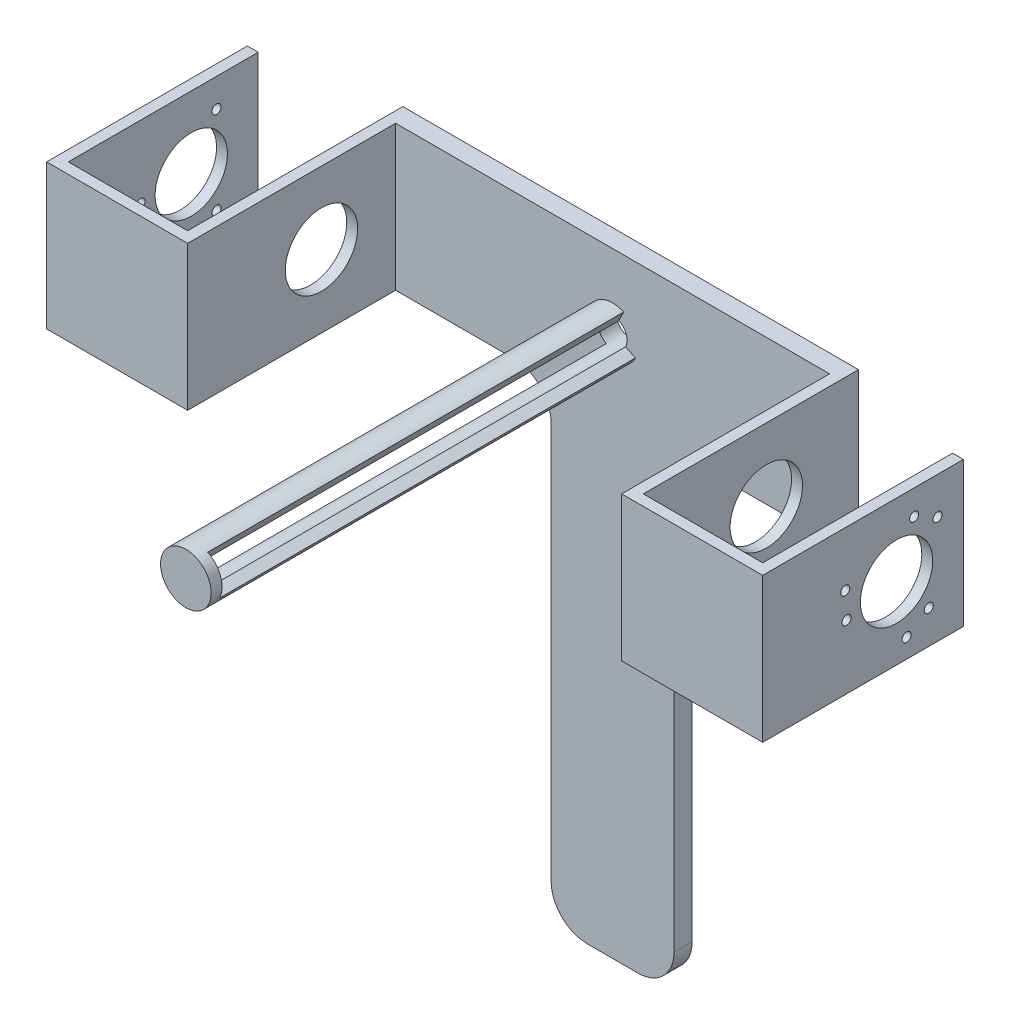
from build123d import *
from build123d.topology import SkipClean

# Parameters (mm, degrees)
BOSS_EXTRUDE2_DEPTH      = 3
BOSS_EXTRUDE2_DEPTH_BACK = 2
SKETCH2_W                = 3
SKETCH2_H                = 40
BOSS_EXTRUDE4_DEPTH      = 39
SKETCH3_W                = 1
SKETCH3_H                = 40
BOSS_EXTRUDE5_DEPTH      = 36
SKETCH4_W                = 1
SKETCH4_H                = 40
BOSS_EXTRUDE6_DEPTH      = 36
SKETCH5_W                = 3
SKETCH5_H                = 40
BOSS_EXTRUDE7_DEPTH      = 36
SKETCH6_R                = 4
CUT_EXTRUDE1_DEPTH       = 228.764510235
CUT_EXTRUDE2_DEPTH       = 36
BOSS_EXTRUDE10_START     = 115
BOSS_EXTRUDE10_DEPTH     = 115
BOSS_EXTRUDE11_START     = 3
SKETCH11_R               = 7
BOSS_EXTRUDE11_DEPTH     = 3
SKETCH12_R               = 10
CUT_EXTRUDE4_DEPTH       = 67
CUT_EXTRUDE5_START       = -67
SKETCH13_R               = 10
CUT_EXTRUDE5_DEPTH       = 67
SKETCH15_W               = 39
SKETCH15_H               = 40
BOSS_EXTRUDE12_DEPTH     = 2
SKETCH16_W               = 33
SKETCH16_H               = 40
CUT_EXTRUDE6_DEPTH       = 52
SKETCH17_W               = 33
SKETCH17_H               = 40
CUT_EXTRUDE7_DEPTH       = 52
SKETCH18_W               = 3
SKETCH18_H               = 40
BOSS_EXTRUDE13_DEPTH     = 16.5
LPATTERN1_COUNT          = 2
LPATTERN1_PITCH          = 36
SKETCH19_W               = 3
SKETCH19_H               = 40
BOSS_EXTRUDE14_DEPTH     = 16.5
LPATTERN2_COUNT          = 2
LPATTERN2_PITCH          = 36
SKETCH21_W               = 3
SKETCH21_H               = 40
BOSS_EXTRUDE16_DEPTH     = 35
SKETCH22_W               = 3
SKETCH22_H               = 40
BOSS_EXTRUDE17_DEPTH     = 35
SKETCH27_R               = 1.25
CUT_EXTRUDE16_DEPTH      = 21
SKETCH29_W               = 32
SKETCH29_H               = 40
CUT_EXTRUDE19_DEPTH      = 10
SKETCH30_W               = 34.030572501
SKETCH30_H               = 34.181917291
CUT_EXTRUDE20_DEPTH      = 10
FILLET1_R                = 10
SKETCH31_R               = 1.25
CUT_EXTRUDE21_DEPTH      = 10


with BuildPart() as part:
    # Sketch1 → Boss-Extrude2 (new, two sides: drawn at the far end of the back side and taken through both)
    with BuildSketch(Plane.XY.offset(-BOSS_EXTRUDE2_DEPTH_BACK)):
        with BuildLine():
            Line((-95, 20), (95, 20))
            Line((95, 20), (95, -20))
            Line((95, -20), (27.321334375, -20))
            ThreePointArc((27.321334375, -20), (20.023048847, -23.023048847), (17, -30.321334375))
            Line((17, -30.321334375), (17, -182.194050733))
            Line((17, -182.194050733), (-17, -182.194050733))
            Line((-17, -182.194050733), (-17, -30.321334375))
            ThreePointArc((-17, -30.321334375), (-20.023048847, -23.023048847), (-27.321334375, -20))
            Line((-27.321334375, -20), (-95, -20))
            Line((-95, -20), (-95, 20))
        make_face()
    extrude(amount=BOSS_EXTRUDE2_DEPTH + BOSS_EXTRUDE2_DEPTH_BACK)

    # Sketch2 → Boss-Extrude4 (add)
    with BuildSketch(Plane.XY.offset(3)):
        with Locations((-93.5, 0)):
            Rectangle(SKETCH2_W, SKETCH2_H)
        with Locations((93.5, 0)):
            Rectangle(SKETCH2_W, SKETCH2_H)
    extrude(amount=BOSS_EXTRUDE4_DEPTH)

    # Sketch3 → Boss-Extrude5 (add)
    with BuildSketch(Plane.ZY.offset(95)):
        with Locations((41.5, 0)):
            Rectangle(SKETCH3_W, SKETCH3_H)
    extrude(amount=BOSS_EXTRUDE5_DEPTH)

    # Sketch4 → Boss-Extrude6 (add)
    with BuildSketch(Plane(origin=(95, 0, 0), x_dir=(0, 0, -1), z_dir=(1, 0, 0))):
        with Locations((-41.5, 0)):
            Rectangle(SKETCH4_W, SKETCH4_H)
    extrude(amount=BOSS_EXTRUDE6_DEPTH)

    # Sketch5 → Boss-Extrude7 (add)
    with BuildSketch(Plane(origin=(0, 0, 41), x_dir=(-1, 0, 0), z_dir=(0, 0, -1))):
        with Locations((-129.5, 0)):
            Rectangle(SKETCH5_W, SKETCH5_H)
        with Locations((129.5, 0)):
            Rectangle(SKETCH5_W, SKETCH5_H)
    extrude(amount=BOSS_EXTRUDE7_DEPTH)

    # Sketch6 → Cut-Extrude1 (cut, through all)
    with BuildSketch(Plane.XY.offset(3)):
        Circle(SKETCH6_R)
    extrude(amount=-CUT_EXTRUDE1_DEPTH, mode=Mode.SUBTRACT)

    # Sketch7 → Cut-Extrude2 (cut)
    with BuildSketch(Plane.XY.offset(3)):
        with BuildLine():
            Line((-17, -182.194050733), (0, -182.194050733))
            ThreePointArc((0, -182.194050733), (-12.02081528, -177.214866013), (-17, -165.194050733))
            Line((-17, -165.194050733), (-17, -182.194050733))
        make_face()
        with BuildLine():
            ThreePointArc((17, -165.194050733), (12.02081528, -177.214866013), (0, -182.194050733))
            Line((0, -182.194050733), (17, -182.194050733))
            Line((17, -182.194050733), (17, -165.194050733))
        make_face()
    extrude(amount=-CUT_EXTRUDE2_DEPTH, mode=Mode.SUBTRACT)

    # Sketch8 → Boss-Extrude10 (add)
    with SkipClean():  # the faces are left unmerged after this step: merging them gives an invalid solid
        with BuildSketch(Plane.XY.offset(3).offset(BOSS_EXTRUDE10_START)):
            with BuildLine():
                Line((-6.304525909, 3.041866706), (-3.602586234, 1.738209546))
                ThreePointArc((-3.602586234, 1.738209546), (-1.318313398, 3.776512913), (1.738209546, 3.602586234))
                Line((1.738209546, 3.602586234), (3.041866706, 6.304525909))
                ThreePointArc((3.041866706, 6.304525909), (-2.307048447, 6.608897598), (-6.304525909, 3.041866706))
            make_face()
            with BuildLine():
                Line((6.304525909, -3.041866706), (3.602586234, -1.738209546))
                ThreePointArc((3.602586234, -1.738209546), (1.318313398, -3.776512913), (-1.738209546, -3.602586234))
                Line((-1.738209546, -3.602586234), (-3.041866706, -6.304525909))
                ThreePointArc((-3.041866706, -6.304525909), (2.307048447, -6.608897598), (6.304525909, -3.041866706))
            make_face()
        extrude(amount=-BOSS_EXTRUDE10_DEPTH)

    # Sketch11 → Boss-Extrude11 (add)
    with SkipClean():  # the faces are left unmerged after this step: merging them gives an invalid solid
        with BuildSketch(Plane.XY.offset(118).offset(BOSS_EXTRUDE11_START)):
            with Locations(Location((0, 0, 0), (0, 0, 154.243185034))):
                Circle(SKETCH11_R)
        extrude(amount=-BOSS_EXTRUDE11_DEPTH)

    # Sketch12 → Cut-Extrude4 (cut)
    with SkipClean():  # the faces are left unmerged after this step: merging them gives an invalid solid
        with BuildSketch(Plane(origin=(131, 0, 0), x_dir=(0, 0, -1), z_dir=(1, 0, 0))):
            with Locations((-23.5, 0)):
                Circle(SKETCH12_R)
        extrude(amount=-CUT_EXTRUDE4_DEPTH, mode=Mode.SUBTRACT)

    # Sketch13 → Cut-Extrude5 (cut)
    with SkipClean():  # the faces are left unmerged after this step: merging them gives an invalid solid
        with BuildSketch(Plane.ZY.offset(131).offset(CUT_EXTRUDE5_START)):
            with Locations(Location((23.5, 0, 0), (0, 0, 180))):
                Circle(SKETCH13_R)
        extrude(amount=CUT_EXTRUDE5_DEPTH, mode=Mode.SUBTRACT)

    # Sketch15 → Boss-Extrude12 (add)
    with SkipClean():  # the faces are left unmerged after this step: merging them gives an invalid solid
        with BuildSketch(Plane.XY.offset(42)):
            with Locations((-111.5, 0)):
                Rectangle(SKETCH15_W, SKETCH15_H)
        boss_extrude12 = extrude(amount=BOSS_EXTRUDE12_DEPTH)

    # Mirror1: Boss-Extrude12 across plane
    with SkipClean():  # the faces are left unmerged after this step: merging them gives an invalid solid
        add(boss_extrude12.mirror(Plane(origin=(0, 0, 0), x_dir=(0, 0, 1), z_dir=(1, 0, 0))))

    # Sketch16 → Cut-Extrude6 (cut)
    with SkipClean():  # the faces are left unmerged after this step: merging them gives an invalid solid
        with BuildSketch(Plane(origin=(0, 0, 41), x_dir=(-1, 0, 0), z_dir=(0, 0, -1))):
            with Locations((111.5, 0)):
                Rectangle(SKETCH16_W, SKETCH16_H)
        extrude(amount=-CUT_EXTRUDE6_DEPTH, mode=Mode.SUBTRACT)


with BuildPart() as cut_extrude6_piece_1:
    # of the separate pieces the step leaves, piece 1, a body of its own (cut_extrude6_pieces)
    add(part.part.solids().sort_by_distance((-92, 20, 3))[0])

    # Sketch17 → Cut-Extrude7 (cut)
    with SkipClean():  # the faces are left unmerged after this step: merging them gives an invalid solid
        with BuildSketch(Plane(origin=(0, 0, 41), x_dir=(-1, 0, 0), z_dir=(0, 0, -1))):
            with Locations((-111.5, 0)):
                Rectangle(SKETCH17_W, SKETCH17_H)
        extrude(amount=-CUT_EXTRUDE7_DEPTH, mode=Mode.SUBTRACT)


with BuildPart() as cut_extrude6_piece_2:
    # of the separate pieces the step leaves, piece 2, a body of its own (cut_extrude6_pieces)
    add(part.part.solids().sort_by_distance((-131, 20, 42))[0])


with BuildPart() as cut_extrude7_piece_1:
    # of the separate pieces the step leaves, piece 1, a body of its own (cut_extrude7_pieces)
    add(cut_extrude6_piece_1.part.solids().sort_by_distance((-92, 20, 3))[0])

    # Sketch18 → Boss-Extrude13 (add)
    with SkipClean():  # the faces are left unmerged after this step: merging them gives an invalid solid
        with BuildSketch(Plane.XY.offset(44)):
            with Locations((-93.5, 0)):
                Rectangle(SKETCH18_W, SKETCH18_H)
        boss_extrude13 = extrude(amount=BOSS_EXTRUDE13_DEPTH)

    # Sketch19 → Boss-Extrude14 (add)
    with SkipClean():  # the faces are left unmerged after this step: merging them gives an invalid solid
        with BuildSketch(Plane.XY.offset(44)):
            with Locations((93.5, 0)):
                Rectangle(SKETCH19_W, SKETCH19_H)
        boss_extrude14 = extrude(amount=BOSS_EXTRUDE14_DEPTH)



with BuildPart() as cut_extrude7_piece_2:
    # of the separate pieces the step leaves, piece 2, a body of its own (cut_extrude7_pieces)
    add(cut_extrude6_piece_1.part.solids().sort_by_distance((128, 20, 41))[0])

    # LPattern2: Boss-Extrude14 ×2
    with Locations(*[(i * LPATTERN2_PITCH, 0, 0) for i in range(1, LPATTERN2_COUNT)]):
        add(boss_extrude14)


with BuildPart() as cut_extrude6_piece_2_1:
    add(cut_extrude6_piece_2.part)

    # LPattern1: Boss-Extrude13 ×2
    with Locations(*[(-i * LPATTERN1_PITCH, 0, 0) for i in range(1, LPATTERN1_COUNT)]):
        add(boss_extrude13)



with BuildPart() as cut_extrude7_piece_1_1:
    with SkipClean():  # the faces are left unmerged after this step: merging them gives an invalid solid
        add(cut_extrude7_piece_1.part)

        add(cut_extrude7_piece_2.part)  # Boss-Extrude16 merges Cut-Extrude7 piece 2
        # Sketch21 → Boss-Extrude16 (add)
        with BuildSketch(Plane.ZY.offset(-128)):
            with Locations((59, 0)):
                Rectangle(SKETCH21_W, SKETCH21_H)
        extrude(amount=BOSS_EXTRUDE16_DEPTH)


with BuildPart() as cut_extrude6_piece_2_2:
    with SkipClean():  # the faces are left unmerged after this step: merging them gives an invalid solid
        add(cut_extrude6_piece_2_1.part)

        add(cut_extrude7_piece_1_1.part)  # Boss-Extrude17 merges Cut-Extrude7 piece 1
        # Sketch22 → Boss-Extrude17 (add)
        with BuildSketch(Plane.ZY.offset(95)):
            with Locations((59, 0)):
                Rectangle(SKETCH22_W, SKETCH22_H)
        extrude(amount=BOSS_EXTRUDE17_DEPTH)

    # Sketch27 → Cut-Extrude16 (cut)
    with SkipClean():  # the faces are left unmerged after this step: merging them gives an invalid solid
        with BuildSketch(Plane(origin=(131, 0, 0), x_dir=(0, 0, -1), z_dir=(1, 0, 0))):
            with Locations((-37.304307679, -2.332614308)):
                Circle(SKETCH27_R)
            with Locations((-18.617949409, 13.121188286)):
                Circle(SKETCH27_R)
            with Locations((-14.577742912, -10.788573977)):
                Circle(SKETCH27_R)
            with Locations((-20.686555586, -14.733788736)):
                Circle(SKETCH27_R)
            with Locations((-12.146886867, 9.803408703)):
                Circle(SKETCH27_R)
            with Locations((-37.666557547, 4.930380034)):
                Circle(SKETCH27_R)
        extrude(amount=-CUT_EXTRUDE16_DEPTH, mode=Mode.SUBTRACT)

    # Sketch29 → Cut-Extrude19 (cut)
    with SkipClean():  # the faces are left unmerged after this step: merging them gives an invalid solid
        with BuildSketch(Plane.XY.offset(3)):
            with Locations((76, 0)):
                Rectangle(SKETCH29_W, SKETCH29_H)
            with Locations((-76, 0)):
                Rectangle(SKETCH29_W, SKETCH29_H)
        extrude(amount=-CUT_EXTRUDE19_DEPTH, mode=Mode.SUBTRACT)


with BuildPart() as cut_extrude19_piece_1:
    # of the separate pieces the step leaves, piece 1, a body of its own (cut_extrude19_pieces)
    add(cut_extrude6_piece_2_2.part.solids().sort_by_distance((-60, 20, 3))[0])


with BuildPart() as cut_extrude19_piece_2:
    # of the separate pieces the step leaves, piece 2, a body of its own (cut_extrude19_pieces)
    add(cut_extrude6_piece_2_2.part.solids().sort_by_distance((-92, 20, 3))[0])


with BuildPart() as cut_extrude19_piece_3:
    # of the separate pieces the step leaves, piece 3, a body of its own (cut_extrude19_pieces)
    add(cut_extrude6_piece_2_2.part.solids().sort_by_distance((131, 20, 60.5))[0])


with BuildPart() as cut_extrude19_piece_2_1:
    # Body-Move/Copy3: read off the stored shape, not the designer's step
    # Body-Move/Copy3: moved
    add(cut_extrude19_piece_2.part.moved(Location((32, 0, 0))))


with BuildPart() as cut_extrude19_piece_3_1:
    # Body-Move/Copy4: read off the stored shape, not the designer's step
    # Body-Move/Copy4: moved
    add(cut_extrude19_piece_3.part.moved(Location((-32, 0, 0))))


with BuildPart() as cut_extrude19_piece_2_2:
    add(cut_extrude19_piece_2_1.part)

    # Combine2: union Cut-Extrude19 piece 1, Cut-Extrude19 piece 3
    add(cut_extrude19_piece_1.part)
    add(cut_extrude19_piece_3_1.part)

    # Sketch30 → Cut-Extrude20 (cut)
    with SkipClean():  # the faces are left unmerged after this step: merging them gives an invalid solid
        with BuildSketch(Plane.XY.offset(3)):
            with Locations((0.015286251, -167.090958645)):
                Rectangle(SKETCH30_W, SKETCH30_H)
        extrude(amount=-CUT_EXTRUDE20_DEPTH, mode=Mode.SUBTRACT)

    # Fillet1
    fillet1_edges = [cut_extrude19_piece_2_2.edges().sort_by_distance(p)[0] for p in [
        (17, -150, 0.5),
        (-17, -150, 0.5),
    ]]
    fillet(fillet1_edges, radius=FILLET1_R)

    # Sketch31 → Cut-Extrude21 (cut)
    with SkipClean():  # the faces are left unmerged after this step: merging them gives an invalid solid
        with BuildSketch(Plane.ZY.offset(99)):
            with Locations((37.5, 0)):
                Circle(SKETCH31_R)
            with Locations((16.5, -12.124355653)):
                Circle(SKETCH31_R)
            with Locations((16.5, 12.124355653)):
                Circle(SKETCH31_R)
        extrude(amount=-CUT_EXTRUDE21_DEPTH, mode=Mode.SUBTRACT)


solid = cut_extrude19_piece_2_2.part
